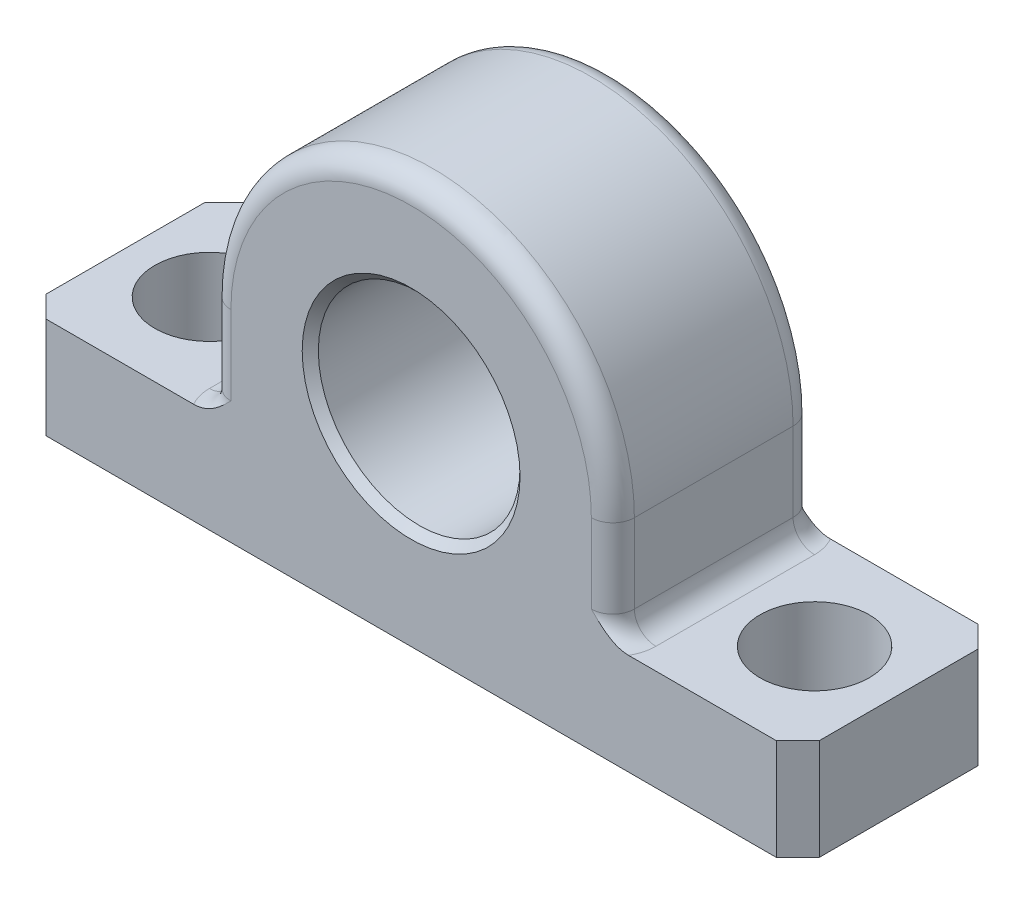
from build123d import *

# Parameters (mm, degrees)
SKETCH2_R          = 4.7625
BODY_EXTRUDE_DEPTH = 4.7625
BODY_FILLET_A_R    = 1.016
BODY_FILLET_B_R    = 1.016
CHAMFER2_SIZE      = 1.016
ID_CHAMFER_SIZE    = 0.381
SKETCH3_R          = 2.5796875
HOLE_CUT_DEPTH     = 24.65886697


with BuildPart() as part:
    # Sketch2 → Body Extrude (new, symmetric)
    with BuildSketch(Plane.XY):
        with BuildLine():
            Line((-18.25625, 0), (-18.25625, 4.7752))
            Line((-18.25625, 4.7752), (-9.525, 4.7752))
            Line((-9.525, 4.7752), (-9.525, 9.525))
            ThreePointArc((-9.525, 9.525), (0, 19.05), (9.525, 9.525))
            Line((9.525, 9.525), (9.525, 4.7752))
            Line((9.525, 4.7752), (18.25625, 4.7752))
            Line((18.25625, 4.7752), (18.25625, 0))
            Line((18.25625, 0), (-18.25625, 0))
        make_face()
        with Locations(Location((0, 9.525, 0), (0, 0, 180))):
            Circle(SKETCH2_R, mode=Mode.SUBTRACT)
    extrude(amount=BODY_EXTRUDE_DEPTH, both=True)

    # Body Fillet A
    body_fillet_a_edges = [part.edges().sort_by_distance(p)[0] for p in [
        (9.525, 7.1501, 4.7625),
        (0, 19.05, 4.7625),
        (-9.525, 7.1501, 4.7625),
        (-9.525, 7.1501, -4.7625),
        (0, 19.05, -4.7625),
        (9.525, 7.1501, -4.7625),
    ]]
    fillet(body_fillet_a_edges, radius=BODY_FILLET_A_R)

    # Body Fillet B
    # the kernel refuses this fillet: 1.016 mm, written as the material it adds along each edge
    with BuildSketch(Plane(origin=(-9.525, 4.7752, 3.7465), x_dir=(0, 1, 0), z_dir=(0, 0, -1))) as body_fillet_b_piece_1:
        with BuildLine():
            CenterArc((BODY_FILLET_B_R, -BODY_FILLET_B_R), BODY_FILLET_B_R, 90, 90)
            Line((0, -BODY_FILLET_B_R), (0, 0))
            Line((0, 0), (BODY_FILLET_B_R, 0))
        make_face()
    extrude(amount=7.493)
    with BuildSketch(Plane(origin=(9.525, 4.7752, 3.7465), x_dir=(0, 1, 0), z_dir=(0, 0, -1))) as body_fillet_b_piece_2:
        with BuildLine():
            CenterArc((BODY_FILLET_B_R, BODY_FILLET_B_R), BODY_FILLET_B_R, 180, 90)
            Line((0, BODY_FILLET_B_R), (0, 0))
            Line((0, 0), (BODY_FILLET_B_R, 0))
        make_face()
    extrude(amount=7.493)
    with BuildSketch(Plane(origin=(-8.509, 4.7752, -3.7465), x_dir=(-1, 0, 0), z_dir=(0, 0, 1))) as body_fillet_b_piece_3_section:
        with BuildLine():
            CenterArc((1.016 + BODY_FILLET_B_R, -BODY_FILLET_B_R), BODY_FILLET_B_R, 90, 90)
            Line((1.016 + BODY_FILLET_B_R, 0), (1.016, 0))
            Line((1.016, 0), (1.016, -BODY_FILLET_B_R))
        make_face()
    body_fillet_b_piece_3 = revolve(axis=Axis((-8.509, 4.7752, -3.7465), (0, -1, 0)), revolution_arc=233.296989237, mode=Mode.PRIVATE)
    body_fillet_b_piece_3 = split(body_fillet_b_piece_3, bisect_by=Plane(origin=(-9.270938019, 5.091814151, -4.7625), z_dir=(0, 0, 1)), keep=Keep.TOP, mode=Mode.PRIVATE)
    add(body_fillet_b_piece_3)
    with BuildSketch(Plane(origin=(8.509, 4.7752, 3.7465), x_dir=(-0.5976672776328273, 0, -0.8017442392976483), z_dir=(0.8017442392976483, 0, -0.5976672776328273))) as body_fillet_b_piece_4_section:
        with BuildLine():
            CenterArc((1.016 + BODY_FILLET_B_R, BODY_FILLET_B_R), BODY_FILLET_B_R, 180, 90)
            Line((1.016, BODY_FILLET_B_R), (1.016, 0))
            Line((1.016, 0), (1.016 + BODY_FILLET_B_R, 0))
        make_face()
    body_fillet_b_piece_4 = revolve(axis=Axis((8.509, 4.7752, 3.7465), (0, 1, 0)), revolution_arc=233.296989237, mode=Mode.PRIVATE)
    body_fillet_b_piece_4 = split(body_fillet_b_piece_4, bisect_by=Plane(origin=(9.270937806, 5.091814769, 4.7625), z_dir=(0, 0, -1)), keep=Keep.TOP, mode=Mode.PRIVATE)
    add(body_fillet_b_piece_4)
    with BuildSketch(Plane(origin=(8.509, 4.7752, -3.7465), x_dir=(1, 0, 0), z_dir=(0, 0, 1))) as body_fillet_b_piece_5_section:
        with BuildLine():
            CenterArc((1.016 + BODY_FILLET_B_R, BODY_FILLET_B_R), BODY_FILLET_B_R, 180, 90)
            Line((1.016 + BODY_FILLET_B_R, 0), (1.016, 0))
            Line((1.016, 0), (1.016, BODY_FILLET_B_R))
        make_face()
    body_fillet_b_piece_5 = revolve(axis=Axis((8.509, 4.7752, -3.7465), (0, 1, 0)), revolution_arc=233.296989237, mode=Mode.PRIVATE)
    body_fillet_b_piece_5 = split(body_fillet_b_piece_5, bisect_by=Plane(origin=(9.270937903, 5.091814444, -4.7625), z_dir=(0, 0, 1)), keep=Keep.TOP, mode=Mode.PRIVATE)
    add(body_fillet_b_piece_5)
    with BuildSketch(Plane(origin=(-8.509, 4.7752, 3.7465), x_dir=(0.5976672776328271, 0, -0.8017442392976484), z_dir=(-0.8017442392976484, 0, -0.5976672776328271))) as body_fillet_b_piece_6_section:
        with BuildLine():
            CenterArc((1.016 + BODY_FILLET_B_R, -BODY_FILLET_B_R), BODY_FILLET_B_R, 90, 90)
            Line((1.016 + BODY_FILLET_B_R, 0), (1.016, 0))
            Line((1.016, 0), (1.016, -BODY_FILLET_B_R))
        make_face()
    body_fillet_b_piece_6 = revolve(axis=Axis((-8.509, 4.7752, 3.7465), (0, -1, 0)), revolution_arc=233.296989237, mode=Mode.PRIVATE)
    body_fillet_b_piece_6 = split(body_fillet_b_piece_6, bisect_by=Plane(origin=(-9.270937967, 5.09181436, 4.7625), z_dir=(0, 0, -1)), keep=Keep.TOP, mode=Mode.PRIVATE)
    add(body_fillet_b_piece_6)

    # Chamfer2
    chamfer2_edges = [part.edges().sort_by_distance(p)[0] for p in [
        (18.25625, 2.3876, -4.7625),
        (-18.25625, 2.3876, 4.7625),
        (18.25625, 2.3876, 4.7625),
        (-18.25625, 2.3876, -4.7625),
    ]]
    chamfer(chamfer2_edges, length=CHAMFER2_SIZE)

    # ID Chamfer
    id_chamfer_edges = [part.edges().sort_by_distance(p)[0] for p in [
        (4.7625, 9.525, -4.7625),
        (4.7625, 9.525, 4.7625),
    ]]
    chamfer(id_chamfer_edges, length=ID_CHAMFER_SIZE)

    # Sketch3 → Hole Cut (cut, through all)
    with BuildSketch(Plane(origin=(0, 4.7752, 0), x_dir=(1, 0, 0), z_dir=(0, 1, 0))):
        with Locations(Location((-14.2875, 0, 0), (0, 0, 180))):
            Circle(SKETCH3_R)
        with Locations((14.2875, 0)):
            Circle(SKETCH3_R)
    extrude(amount=-HOLE_CUT_DEPTH, mode=Mode.SUBTRACT)


solid = part.part
